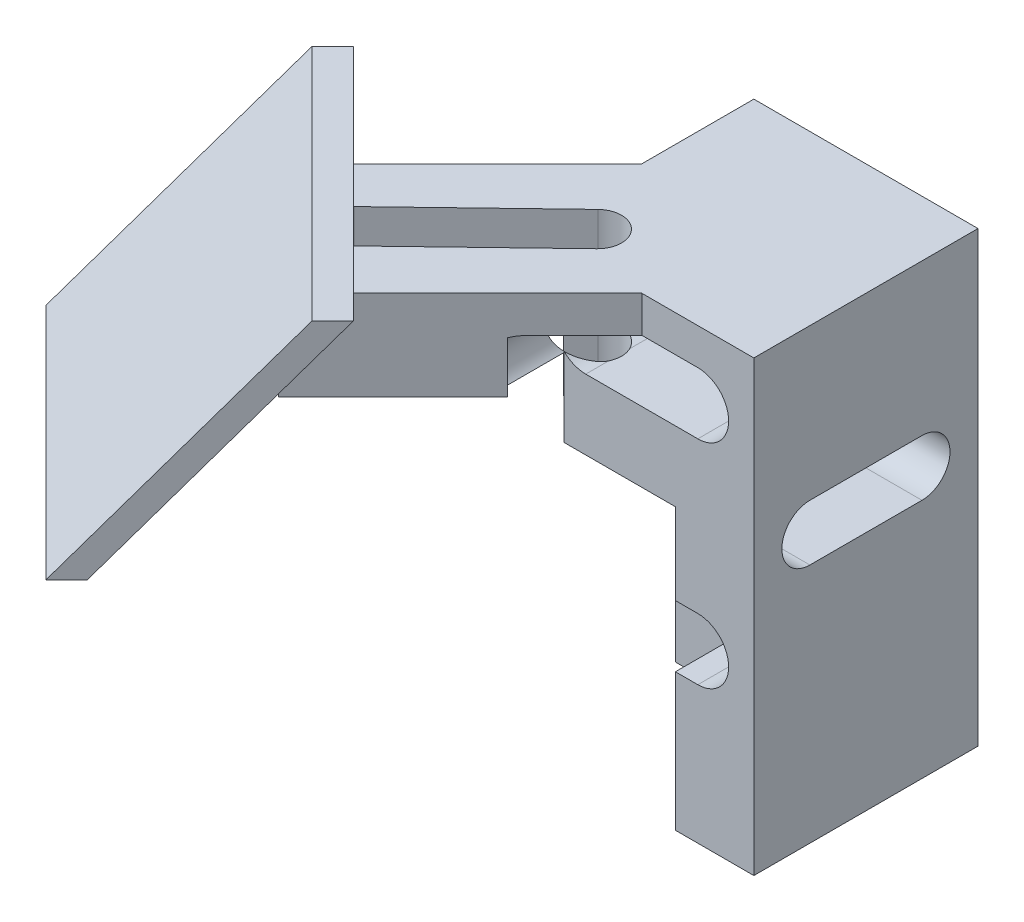
from build123d import *
from build123d.topology import SkipClean

# Parameters (mm, degrees)
SKETCH_1_W           = 20
SKETCH_1_H           = 50
EXTRUDE_2_DEPTH      = 20
SKETCH_2_W           = 20
SKETCH_2_H           = 10
CUT_EXTRUDE_1_DEPTH  = 20
CUT_EXTRUDE_2_DEPTH  = 20
CUT_EXTRUDE_3_DEPTH  = 20
CUT_EXTRUDE_4_DEPTH  = 20
SKETCH_6_W           = 13
SKETCH_6_H           = 13
CUT_EXTRUDE_5_DEPTH  = 25
EXTRUDE_3_DEPTH      = 8
EXTRUDE_6_DEPTH      = 10
EXTRUDE_6_DEPTH_BACK = 20
CUT_EXTRUDE_7_DEPTH  = 18
CUT_EXTRUDE_8_DEPTH  = 26
CUT_EXTRUDE_9_DEPTH  = 26


with BuildPart() as part:
    # 草图1 → 凸台-拉伸2 (new body)
    with BuildSketch(Plane(origin=(0, 0, 0), x_dir=(0, 0, -1), z_dir=(1, 0, 0))):
        Rectangle(SKETCH_1_W, SKETCH_1_H)
    extrude(amount=EXTRUDE_2_DEPTH)

    # 草图2 → 切除-拉伸1 (cut)
    with BuildSketch(Plane(origin=(20, 0, 0), x_dir=(0, 0, -1), z_dir=(1, 0, 0))):
        with Locations((0, -20)):
            Rectangle(SKETCH_2_W, SKETCH_2_H)
    extrude(amount=-CUT_EXTRUDE_1_DEPTH, mode=Mode.SUBTRACT)

    # 草图3 → 切除-拉伸2 (cut)
    with BuildSketch(Plane(origin=(0, 0, -10), x_dir=(-1, 0, 0), z_dir=(0, 0, -1))):
        with BuildLine():
            Line((-15, 21.75), (-5, 21.75))
            ThreePointArc((-5, 21.75), (-2.25, 19), (-5, 16.25))
            Line((-5, 16.25), (-15, 16.25))
            ThreePointArc((-15, 16.25), (-17.75, 19), (-15, 21.75))
        make_face()
    extrude(amount=-CUT_EXTRUDE_2_DEPTH, mode=Mode.SUBTRACT)

    # 草图4 → 切除-拉伸3 (cut)
    with BuildSketch(Plane.ZY):
        with BuildLine():
            Line((-5, 11.5), (5, 11.5))
            ThreePointArc((5, 11.5), (7.5, 9), (5, 6.5))
            Line((5, 6.5), (-5, 6.5))
            ThreePointArc((-5, 6.5), (-7.5, 9), (-5, 11.5))
        make_face()
    extrude(amount=-CUT_EXTRUDE_3_DEPTH, mode=Mode.SUBTRACT)

    # 草图5 → 切除-拉伸4 (cut)
    with BuildSketch(Plane(origin=(0, 0, -10), x_dir=(-1, 0, 0), z_dir=(0, 0, -1))):
        with BuildLine():
            Line((-15, 2.75), (-5, 2.75))
            ThreePointArc((-5, 2.75), (-2.25, 0), (-5, -2.75))
            Line((-5, -2.75), (-15, -2.75))
            ThreePointArc((-15, -2.75), (-17.75, 0), (-15, 2.75))
        make_face()
    extrude(amount=-CUT_EXTRUDE_4_DEPTH, mode=Mode.SUBTRACT)

    # 草图6 → 切除-拉伸5 (cut)
    with BuildSketch(Plane.XZ.offset(15)):
        with Locations((6.5, 3.5)):
            Rectangle(SKETCH_6_W, SKETCH_6_H)
    extrude(amount=-CUT_EXTRUDE_5_DEPTH, mode=Mode.SUBTRACT)

    # 草图7 → 凸台-拉伸3 (add)
    with BuildSketch(Plane(origin=(0, 25, 0), x_dir=(1, 0, 0), z_dir=(0, 1, 0))):
        Polygon((-16.213203436, -16.213203436), (-6.213203436, -26.213203436), (10, -10), (0, 0), align=None)
    extrude(amount=-EXTRUDE_3_DEPTH)

    # 草图8 → 凸台-拉伸6 (add, two sides: drawn at the far end of the back side and taken through both)
    with BuildSketch(Plane(origin=(0, 0, 0), x_dir=(-0.707106781186539, 0, 0.707106781186556), z_dir=(-0.707106781186556, 0, -0.707106781186539)).offset(-EXTRUDE_6_DEPTH_BACK)):
        Polygon((18.197319143, 27), (34.979311766, 7), (37.590126345, 7), (20.808133721, 27), align=None)
    extrude(amount=EXTRUDE_6_DEPTH + EXTRUDE_6_DEPTH_BACK)

    # 草图11 → 切除-拉伸7 (cut)
    with BuildSketch(Plane(origin=(10, 0, 10), x_dir=(0.7071067811865497, 0, -0.7071067811865454), z_dir=(0.7071067811865454, 0, 0.7071067811865497))):
        Polygon((-22.928932188, 24.472530808), (-22.486332984, 25), (-22.928932188, 25), align=None)
    extrude(amount=-CUT_EXTRUDE_7_DEPTH, mode=Mode.SUBTRACT)

    # 草图12 → 切除-拉伸8 (cut)
    with SkipClean():  # the faces are left unmerged after this step: merging them gives an invalid solid
        with BuildSketch(Plane(origin=(0, 0, -10), x_dir=(-1, 0, 0), z_dir=(0, 0, -1))):
            with BuildLine():
                Line((-15, 16.25), (-5, 16.25))
                ThreePointArc((-5, 16.25), (-2.25, 19), (-5, 21.75))
                Line((-5, 21.75), (-15, 21.75))
                ThreePointArc((-15, 21.75), (-17.75, 19), (-15, 16.25))
            make_face()
        extrude(amount=-CUT_EXTRUDE_8_DEPTH, mode=Mode.SUBTRACT)
    add(part.part.scale(1), mode=Mode.REPLACE)  # the faces are merged on a copy

    # 草图13 → 切除-拉伸9 (cut)
    with BuildSketch(Plane(origin=(0, 25, 0), x_dir=(1, 0, 0), z_dir=(0, 1, 0))):
        with BuildLine():
            Line((-9.534541797, -16.138807841), (1.572830507, -5.47197893))
            ThreePointArc((1.572830507, -5.47197893), (4.614784317, -5.533524822), (4.553238425, -8.575478633))
            Line((4.553238425, -8.575478633), (-6.554133879, -19.242307544))
            ThreePointArc((-6.554133879, -19.242307544), (-9.596087689, -19.180761651), (-9.534541797, -16.138807841))
        make_face()
    extrude(amount=-CUT_EXTRUDE_9_DEPTH, mode=Mode.SUBTRACT)


solid = part.part
